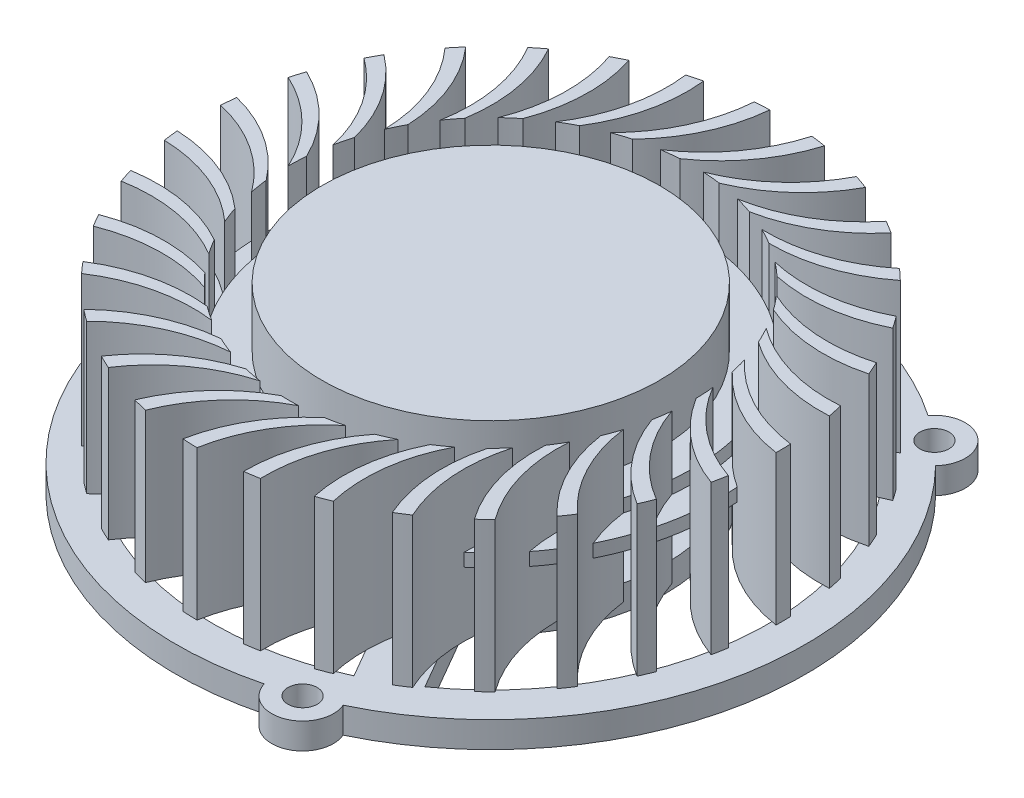
from build123d import *

# Parameters (mm, degrees)
SKETCH1_R           = 24.225
BOSS_EXTRUDE1_DEPTH = 2
SKETCH3_R           = 2.375
SKETCH3_R_2         = 1.125
BOSS_EXTRUDE2_DEPTH = 2
SKETCH3_2_R         = 1.125
CUT_EXTRUDE1_DEPTH  = 2
BOSS_EXTRUDE3_START = -11.5
BOSS_EXTRUDE3_DEPTH = 11.5
CUT_EXTRUDE3_START  = -1.6
CUT_EXTRUDE3_DEPTH  = 1.6
CIRPATTERN2_COUNT   = 31


with BuildPart() as part:
    # Sketch1 → Boss-Extrude1 (new body)
    with BuildSketch(Plane(origin=(0, 0, 0), x_dir=(1, 0, 0), z_dir=(0, 1, 0))):
        Circle(SKETCH1_R)
        with BuildLine():
            Line((8.933672621, 19.473574877), (4.918184151, 12.51854483))
            ThreePointArc((4.918184151, 12.51854483), (-6.725, 11.648041681), (-13.300469917, 2))
            Line((-13.300469917, 2), (-21.331446857, 2))
            ThreePointArc((-21.331446857, 2), (-10.7125, 18.554594276), (8.933672621, 19.473574877))
        make_face(mode=Mode.SUBTRACT)
        with BuildLine():
            Line((8.382285766, 10.51854483), (12.397774236, 17.473574877))
            ThreePointArc((12.397774236, 17.473574877), (21.425, 0), (12.397774236, -17.473574877))
            Line((12.397774236, -17.473574877), (8.382285766, -10.51854483))
            ThreePointArc((8.382285766, -10.51854483), (13.45, 0), (8.382285766, 10.51854483))
        make_face(mode=Mode.SUBTRACT)
        with BuildLine():
            ThreePointArc((-13.300469917, -2), (-6.725, -11.648041681), (4.918184151, -12.51854483))
            Line((4.918184151, -12.51854483), (8.933672621, -19.473574877))
            ThreePointArc((8.933672621, -19.473574877), (-10.7125, -18.554594276), (-21.331446857, -2))
            Line((-21.331446857, -2), (-13.300469917, -2))
        make_face(mode=Mode.SUBTRACT)
    extrude(amount=-BOSS_EXTRUDE1_DEPTH)

    # Sketch2 → Revolve1 (revolve)
    with BuildSketch(Plane.XY):
        Polygon((0, 0), (0, 12), (13, 12), (13, 7.443424917), (15.6, 7.443424917), (15.6, 6.443424917), (22.3, 6.443424917), (22.3, 5.443424917), (10, 5.443424917), (10, 0), align=None)
    revolve(axis=Axis((0, 0, 0), (0, 1, 0)))

    # Sketch3 → Boss-Extrude2 (add)
    # profile 1 of 3: a face of its own
    with BuildSketch(Plane(origin=(0, 0, 0), x_dir=(1, 0, 0), z_dir=(0, 1, 0))):
        with Locations((-23.880318895, 4.210744529)):
            Circle(SKETCH3_R)
        with Locations((-23.880318895, 4.210744529)):
            Circle(SKETCH3_R_2, mode=Mode.SUBTRACT)
    # profile 2 of 3: a face of its own
    with BuildSketch(Plane(origin=(0, 0, 0), x_dir=(1, 0, 0), z_dir=(0, 1, 0))):
        with Locations((8.293547716, -22.786335078)):
            Circle(SKETCH3_R)
        with Locations((8.293547716, -22.786335078)):
            Circle(SKETCH3_R_2, mode=Mode.SUBTRACT)
    # profile 3 of 3: a face of its own
    with BuildSketch(Plane(origin=(0, 0, 0), x_dir=(1, 0, 0), z_dir=(0, 1, 0))):
        with Locations((15.586771178, 18.575590549)):
            Circle(SKETCH3_R)
        with Locations((15.586771178, 18.575590549)):
            Circle(SKETCH3_R_2, mode=Mode.SUBTRACT)
    extrude(amount=-BOSS_EXTRUDE2_DEPTH)

    # Sketch3<2> → Cut-Extrude1 (cut)
    with BuildSketch(Plane(origin=(0, 0, 0), x_dir=(1, 0, 0), z_dir=(0, 1, 0))):
        with Locations((-23.880318895, 4.210744529)):
            Circle(SKETCH3_2_R)
        with Locations((15.586771178, 18.575590549)):
            Circle(SKETCH3_2_R)
        with Locations((8.293547716, -22.786335078)):
            Circle(SKETCH3_2_R)
    extrude(amount=-CUT_EXTRUDE1_DEPTH, mode=Mode.SUBTRACT)

    # Sketch4 → Boss-Extrude3 (add)
    with BuildSketch(Plane(origin=(0, 12, 0), x_dir=(1, 0, 0), z_dir=(0, 1, 0)).offset(BOSS_EXTRUDE3_START)):
        with BuildLine():
            ThreePointArc((-21.176069913, 6.990283475), (-17.877110515, 4.654194125), (-15.541021164, 1.355234727))
            ThreePointArc((-15.541021164, 1.355234727), (-15.585248316, 0.678258739), (-15.6, 0))
            ThreePointArc((-15.6, 0), (-18.022011129, 3.482185308), (-21.504196438, 5.904196438))
            ThreePointArc((-21.504196438, 5.904196438), (-21.347041486, 6.449327082), (-21.176069913, 6.990283475))
        make_face()
    boss_extrude3 = extrude(amount=BOSS_EXTRUDE3_DEPTH)

    # Sketch5 → Cut-Extrude3 (cut)
    with BuildSketch(Plane(origin=(0, 6.443424917, 0), x_dir=(1, 0, 0), z_dir=(0, 1, 0)).offset(CUT_EXTRUDE3_START)):
        with BuildLine():
            ThreePointArc((-17.167179201, 3.879169791), (1.951620616, 17.491460116), (17.6, 0))
            ThreePointArc((17.6, 0), (-1.397077369, -17.544462797), (-17.378201685, 2.785337719))
            ThreePointArc((-17.378201685, 2.785337719), (-19.271168094, 4.569704127), (-21.504196438, 5.904196438))
            ThreePointArc((-21.504196438, 5.904196438), (21.347041486, -6.449327082), (-21.176069913, 6.990283475))
            ThreePointArc((-21.176069913, 6.990283475), (-19.005293826, 5.649055581), (-17.167179201, 3.879169791))
        make_face()
    extrude(amount=CUT_EXTRUDE3_DEPTH, mode=Mode.SUBTRACT)

    # CirPattern2: Boss-Extrude3 ×31 about axis
    cirpattern2_axis = Axis((0, 0, 0), (0, -1, 0))
    for i in range(1, CIRPATTERN2_COUNT):
        add(boss_extrude3.rotate(cirpattern2_axis, i * 360 / CIRPATTERN2_COUNT))


solid = part.part
